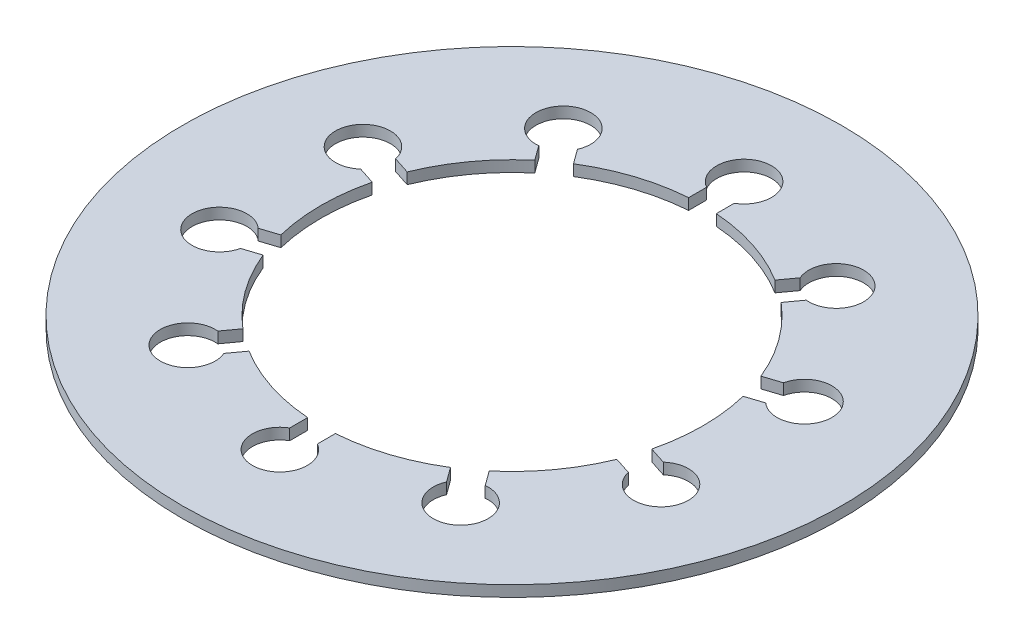
from build123d import *

# Parameters (mm, degrees)
SKETCH1_R           = 30.2006
SKETCH1_R_2         = 17.5006
BOSS_EXTRUDE1_DEPTH = 1.016
CUT_EXTRUDE1_DEPTH  = 43.722180852
CIRPATTERN1_COUNT   = 10


with BuildPart() as part:
    # Sketch1 → Boss-Extrude1 (new body)
    with BuildSketch(Plane(origin=(0, 0, 0), x_dir=(1, 0, 0), z_dir=(0, 1, 0))):
        Circle(SKETCH1_R)
        Circle(SKETCH1_R_2, mode=Mode.SUBTRACT)
    extrude(amount=BOSS_EXTRUDE1_DEPTH)

    # Sketch2 → Cut-Extrude1 (cut, through all)
    with BuildSketch(Plane(origin=(0, 1.016, 0), x_dir=(1, 0, 0), z_dir=(0, 1, 0))):
        with BuildLine():
            Line((-1.27, 17.454457894), (1.27, 17.454457894))
            Line((1.27, 17.454457894), (1.27, 19.102174412))
            ThreePointArc((1.27, 19.102174412), (0, 23.7871), (-1.27, 19.102174412))
            Line((-1.27, 19.102174412), (-1.27, 17.454457894))
        make_face()
    cut_extrude1 = extrude(amount=-CUT_EXTRUDE1_DEPTH, mode=Mode.SUBTRACT)

    # CirPattern1: Cut-Extrude1 ×10 about axis
    cirpattern1_axis = Axis((0, 1.016, 0), (0, -1, 0))
    for i in range(1, CIRPATTERN1_COUNT):
        add(cut_extrude1.rotate(cirpattern1_axis, i * 360 / CIRPATTERN1_COUNT), mode=Mode.SUBTRACT)


solid = part.part
